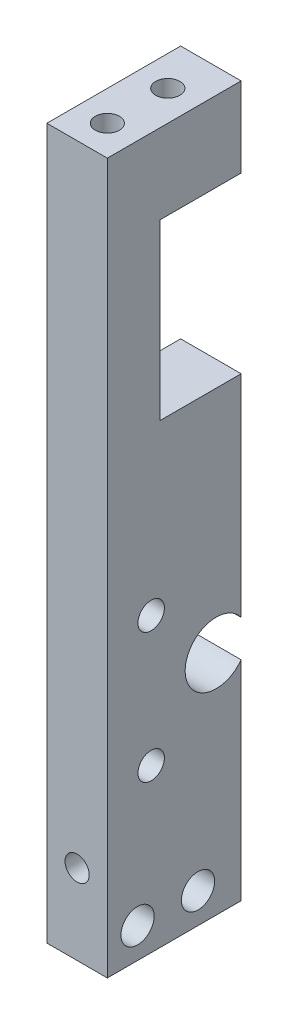
from build123d import *

# Parameters (mm, degrees)
MAIN_STOCK_START                  = 2.248090434
SKETCH_1_W                        = 4
SKETCH_1_H                        = 46.98
MAIN_STOCK_DEPTH                  = 8.851909566
SKETCH_2_R                        = 0.8
FRAME_1XD1P6_THROUGH_DEPTH        = 70.124968014
SKETCH_3_R                        = 2.05
SMA_CENTER_D4P1_DEPTH             = 4
SKETCH_4_R                        = 0.875
SMA_UPPER_2XD1P75_THROUGH_DEPTH   = 45.280835584
SKETCH_5_W                        = 6.7
SKETCH_5_H                        = 11.5
TYPEC_WINDOW_11P5X6P7_DEPTH       = 4
SKETCH_6_R                        = 1.1
CORNER_FRONT_2XD2P2_THROUGH_DEPTH = 45.280835584
SKETCH_7_R                        = 0.8
CORNER_REAR_2XD1P6_BLIND4_DEPTH   = 4


with BuildPart() as part:
    # 草图1 → Main_Stock (new body)
    with BuildSketch(Plane.XY.offset(MAIN_STOCK_START)):
        with Locations((51.65, 19.19)):
            Rectangle(SKETCH_1_W, SKETCH_1_H)
    extrude(amount=MAIN_STOCK_DEPTH)

    # 草图2 → Frame_1xD1p6_Through (cut, through all)
    with BuildSketch(Plane.XY.offset(11.1)):
        with Locations((51.65, 1)):
            Circle(SKETCH_2_R)
    extrude(amount=-FRAME_1XD1P6_THROUGH_DEPTH, mode=Mode.SUBTRACT)

    # 草图3 → SMA_Center_D4p1 (cut)
    with BuildSketch(Plane(origin=(53.65, 0, 0), x_dir=(0, 0, -1), z_dir=(1, 0, 0))):
        with Locations((-3.899496327, 10.725)):
            Circle(SKETCH_3_R)
    extrude(amount=-SMA_CENTER_D4P1_DEPTH, mode=Mode.SUBTRACT)

    # 草图4 → SMA_Upper_2xD1p75_Through (cut, through all)
    with BuildSketch(Plane(origin=(53.65, 0, 0), x_dir=(0, 0, -1), z_dir=(1, 0, 0))):
        with Locations((-8.199496327, 6.425)):
            Circle(SKETCH_4_R)
        with Locations((-8.199496327, 15.025)):
            Circle(SKETCH_4_R)
    extrude(amount=-SMA_UPPER_2XD1P75_THROUGH_DEPTH, mode=Mode.SUBTRACT)

    # 草图5 → TypeC_Window_11p5x6p7 (cut)
    with BuildSketch(Plane(origin=(53.65, 0, 0), x_dir=(0, 0, -1), z_dir=(1, 0, 0))):
        with Locations((-4.25, 31.65)):
            Rectangle(SKETCH_5_W, SKETCH_5_H)
    extrude(amount=-TYPEC_WINDOW_11P5X6P7_DEPTH, mode=Mode.SUBTRACT)

    # 草图6 → Corner_Front_2xD2p2_Through (cut, through all)
    with BuildSketch(Plane(origin=(53.65, 0, 0), x_dir=(0, 0, -1), z_dir=(1, 0, 0))):
        with Locations((-5.1, -2.3)):
            Circle(SKETCH_6_R)
        with Locations((-9.1, -2.3)):
            Circle(SKETCH_6_R)
    extrude(amount=-CORNER_FRONT_2XD2P2_THROUGH_DEPTH, mode=Mode.SUBTRACT)

    # 草图7 → Corner_Rear_2xD1p6_Blind4 (cut)
    with BuildSketch(Plane(origin=(0, 42.68, 0), x_dir=(1, 0, 0), z_dir=(0, 1, 0))):
        with Locations((51.65, -5.1)):
            Circle(SKETCH_7_R)
        with Locations((51.65, -9.1)):
            Circle(SKETCH_7_R)
    extrude(amount=-CORNER_REAR_2XD1P6_BLIND4_DEPTH, mode=Mode.SUBTRACT)


solid = part.part
